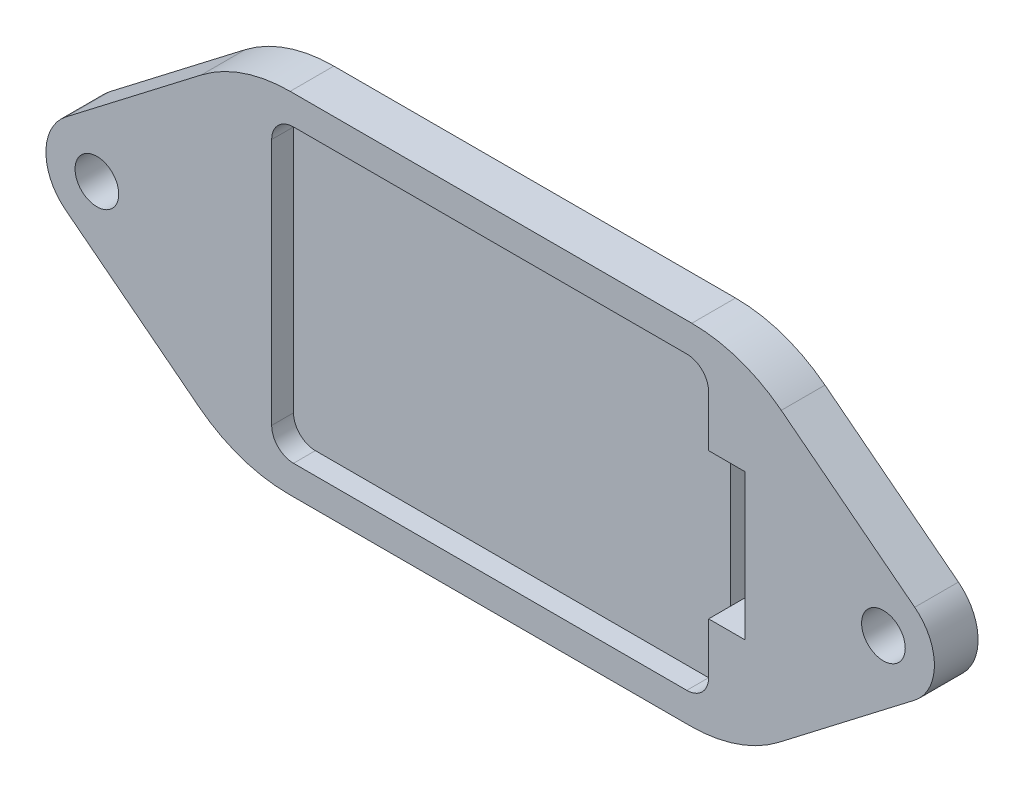
from build123d import *

# Parameters (mm, degrees)
SKETCH1_R           = 1.5
BOSS_EXTRUDE1_DEPTH = 3
BOSS_EXTRUDE2_DEPTH = 1.5


with BuildPart() as part:
    # Sketch1 → Boss-Extrude1 (new body)
    with BuildSketch(Plane.XY):
        with BuildLine():
            Line((-19.825983334, 9.928557115), (-29.132932911, 2.77499499))
            ThreePointArc((-29.132932911, 2.77499499), (-30.499984057, 0.010564243), (-29.149645812, -2.762068587))
            Line((-29.149645812, -2.762068587), (-19.988916909, -9.891624535))
            ThreePointArc((-19.988916909, -9.891624535), (-17.093897461, -11.45823042), (-13.847071731, -12))
            Line((-13.847071731, -12), (13.731889302, -12))
            ThreePointArc((13.731889302, -12), (16.950151943, -11.467987409), (19.825983334, -9.928557115))
            Line((19.825983334, -9.928557115), (29.132932911, -2.77499499))
            ThreePointArc((29.132932911, -2.77499499), (30.499984057, -0.010564243), (29.149645812, 2.762068587))
            Line((29.149645812, 2.762068587), (19.988916909, 9.891624535))
            ThreePointArc((19.988916909, 9.891624535), (17.093897461, 11.45823042), (13.847071731, 12))
            Line((13.847071731, 12), (-13.731889302, 12))
            ThreePointArc((-13.731889302, 12), (-16.950151943, 11.467987409), (-19.825983334, 9.928557115))
        make_face()
        with BuildLine():
            Line((13.5, -10), (-13.5, -10))
            ThreePointArc((-13.5, -10), (-14.560660172, -9.560660172), (-15, -8.5))
            Line((-15, -8.5), (-15, 8.5))
            ThreePointArc((-15, 8.5), (-14.560660172, 9.560660172), (-13.5, 10))
            Line((-13.5, 10), (13.5, 10))
            ThreePointArc((13.5, 10), (14.560660172, 9.560660172), (15, 8.5))
            Line((15, 8.5), (15, 5))
            Line((15, 5), (17.5, 5))
            Line((17.5, 5), (17.5, -5))
            Line((17.5, -5), (15, -5))
            Line((15, -5), (15, -8.5))
            ThreePointArc((15, -8.5), (14.560660172, -9.560660172), (13.5, -10))
        make_face(mode=Mode.SUBTRACT)
        with Locations((-27, 0)):
            Circle(SKETCH1_R, mode=Mode.SUBTRACT)
        with Locations((27, 0)):
            Circle(SKETCH1_R, mode=Mode.SUBTRACT)
    extrude(amount=BOSS_EXTRUDE1_DEPTH)

    # Sketch1<3> → Boss-Extrude2 (add)
    with BuildSketch(Plane.XY):
        with BuildLine():
            ThreePointArc((-15, -8.5), (-14.560660172, -9.560660172), (-13.5, -10))
            Line((-13.5, -10), (13.5, -10))
            ThreePointArc((13.5, -10), (14.560660172, -9.560660172), (15, -8.5))
            Line((15, -8.5), (15, -5))
            Line((15, -5), (15, 5))
            Line((15, 5), (15, 8.5))
            ThreePointArc((15, 8.5), (14.560660172, 9.560660172), (13.5, 10))
            Line((13.5, 10), (-13.5, 10))
            ThreePointArc((-13.5, 10), (-14.560660172, 9.560660172), (-15, 8.5))
            Line((-15, 8.5), (-15, -8.5))
        make_face()
    extrude(amount=BOSS_EXTRUDE2_DEPTH)


solid = part.part
